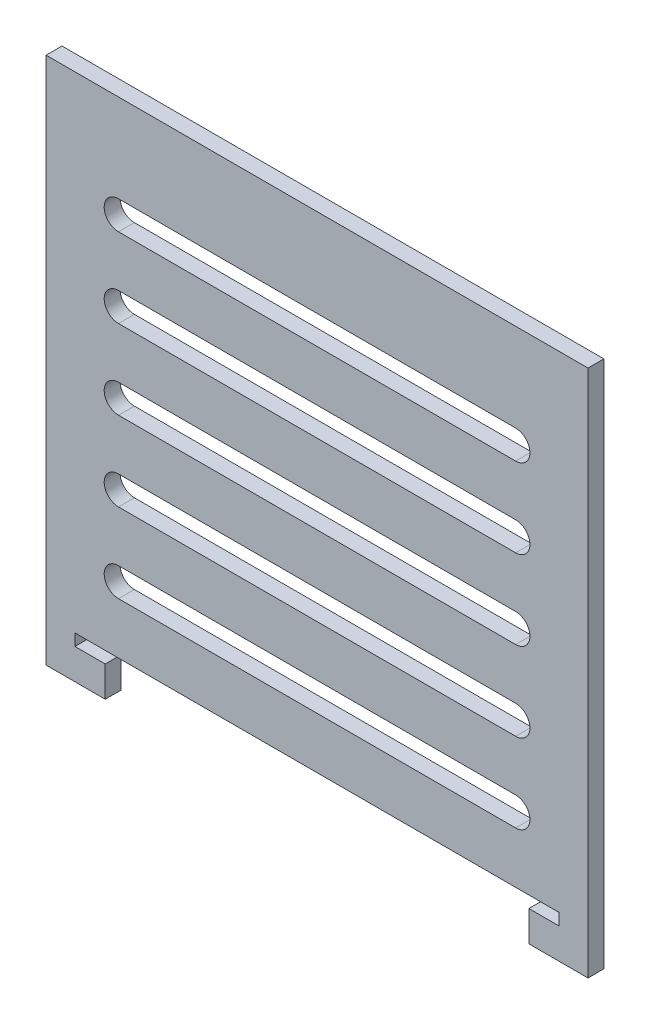
from build123d import *

# Parameters (mm, degrees)
BOSS_EXTRUDE1_DEPTH = 5
LPATTERN1_DEPTH     = 5


# Read off the part's stored shape, not the designer's step: LPattern1
with BuildPart() as part:
    # Sketch1 → Boss-Extrude1 (new body)
    with BuildSketch(Plane.XY):
        Polygon((0, 0), (0, 9.63), (-9.53, 9.63), (-9.53, 13.32), (142.87, 13.32), (142.87, 9.63), (133.34, 9.63), (133.34, 0), (151.95, 0), (151.95, 166.26), (-18.61, 166.26), (-18.61, 0), align=None)
        with BuildLine():
            Line((4.17, 38.509583336), (129.17, 38.509583336))
            ThreePointArc((129.17, 38.509583336), (133.67, 34.009583336), (129.17, 29.509583336))
            Line((129.17, 29.509583336), (4.17, 29.509583336))
            ThreePointArc((4.17, 29.509583336), (-0.33, 34.009583336), (4.17, 38.509583336))
        make_face(mode=Mode.SUBTRACT)
    extrude(amount=BOSS_EXTRUDE1_DEPTH)

    # LPattern1 outline → LPattern1 (cut)
    with BuildSketch(Plane.XY):
        with BuildLine():
            Line((4.17, 129.509583336), (129.17, 129.509583336))
            ThreePointArc((129.17, 129.509583336), (133.67, 134.009583336), (129.17, 138.509583336))
            Line((129.17, 138.509583336), (4.17, 138.509583336))
            ThreePointArc((4.17, 138.509583336), (-0.33, 134.009583336), (4.17, 129.509583336))
        make_face()
        with BuildLine():
            Line((4.17, 104.509583336), (129.17, 104.509583336))
            ThreePointArc((129.17, 104.509583336), (133.67, 109.009583336), (129.17, 113.509583336))
            Line((129.17, 113.509583336), (4.17, 113.509583336))
            ThreePointArc((4.17, 113.509583336), (-0.33, 109.009583336), (4.17, 104.509583336))
        make_face()
        with BuildLine():
            Line((4.17, 79.509583336), (129.17, 79.509583336))
            ThreePointArc((129.17, 79.509583336), (133.67, 84.009583336), (129.17, 88.509583336))
            Line((129.17, 88.509583336), (4.17, 88.509583336))
            ThreePointArc((4.17, 88.509583336), (-0.33, 84.009583336), (4.17, 79.509583336))
        make_face()
        with BuildLine():
            Line((4.17, 54.509583336), (129.17, 54.509583336))
            ThreePointArc((129.17, 54.509583336), (133.67, 59.009583336), (129.17, 63.509583336))
            Line((129.17, 63.509583336), (4.17, 63.509583336))
            ThreePointArc((4.17, 63.509583336), (-0.33, 59.009583336), (4.17, 54.509583336))
        make_face()
    extrude(amount=LPATTERN1_DEPTH, mode=Mode.SUBTRACT)


solid = part.part
